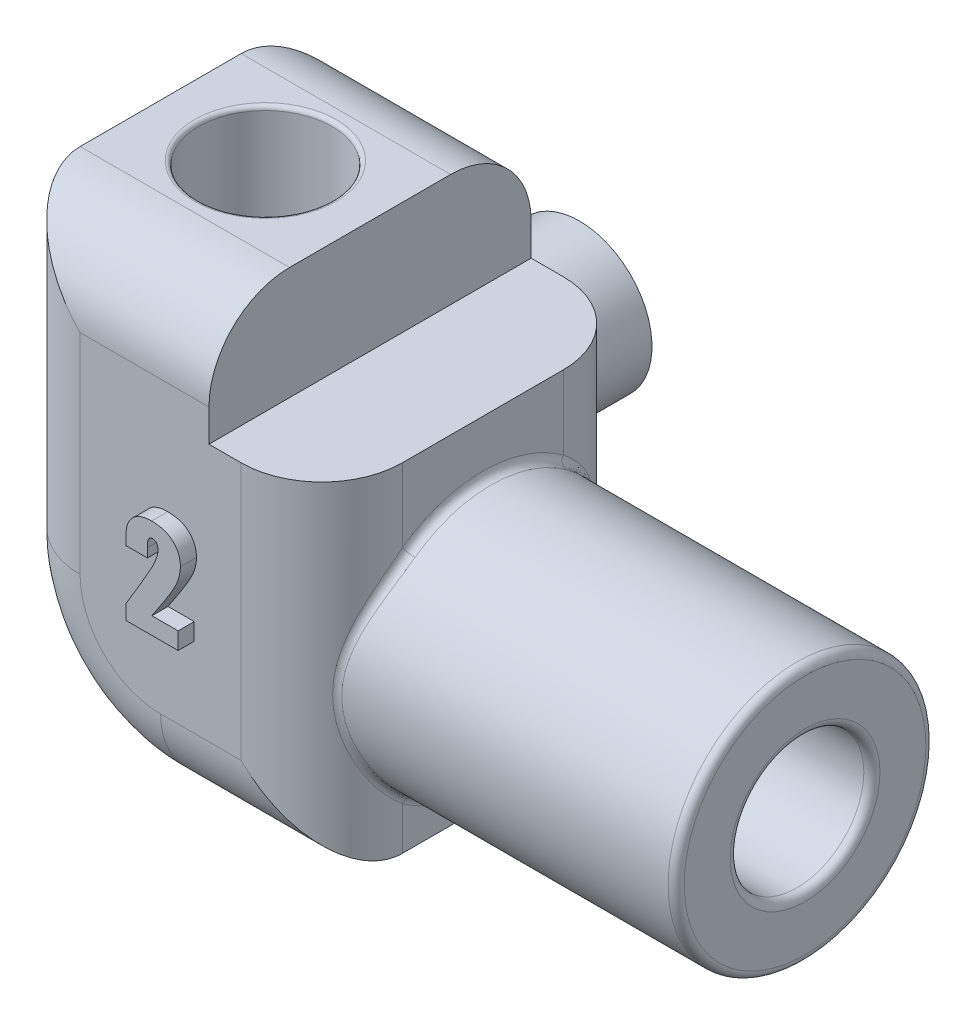
from build123d import *
from build123d.topology import SkipClean

# Parameters (mm, degrees)
BOSS_EXTRU_1_DEPTH       = 10
BOSS_EXTRU_1_DEPTH_BACK  = 10
ESQUISSE2_R              = 4
ENL_V_MAT_EXTRU_1_DEPTH  = 7
ESQUISSE3_W              = 20
ESQUISSE3_H              = 20
BOSS_EXTRU_2_DEPTH       = 8
EMPREINTE1_START         = -10
EMPREINTE1_OUTLINE_R     = 4
EMPREINTE1_DEPTH         = 14.813354444
CONG_1_R                 = 10
CONG_2_R                 = 5
ESQUISSE4_R              = 4.5
BOSS_EXTRU_3_DEPTH       = 6
ESQUISSE5_R              = 1.75
ENL_V_MAT_EXTRU_2_DEPTH  = 5
CONG_3_R                 = 0.25
ESQUISSE6_R              = 4.15
ENL_V_MAT_EXTRU_3_DEPTH  = 7
ESQUISSE7_R              = 4.15
ENL_V_MAT_EXTRU_4_DEPTH  = 14.813354444
BOSS_EXTRU_4_OUTLINE_R   = 8
BOSS_EXTRU_4_OUTLINE_R_2 = 4.15
BOSS_EXTRU_4_DEPTH       = 20
BOSS_EXTRU_4_START       = -5
BOSS_EXTRU_4_2_DEPTH     = 5
ESQUISSE9_R              = 8
ESQUISSE9_R_2            = 4.15
BOSS_EXTRU_6_DEPTH       = 22
CONG_5_R                 = 0.5
CONG_6_R                 = 0.25
CONG_7_R                 = 0.5
BOSS_EXTRU_7_DEPTH       = 1


with BuildPart() as part:
    # Esquisse1 → Boss.-Extru.1 (new, two sides: drawn at the far end of the back side and taken through both)
    with BuildSketch(Plane.XY.offset(-BOSS_EXTRU_1_DEPTH_BACK)):
        Polygon((-3, -10), (10, -10), (10, 10), (-10, 10), (-10, -3), (-3, -3), align=None)
    extrude(amount=BOSS_EXTRU_1_DEPTH + BOSS_EXTRU_1_DEPTH_BACK)

    # Esquisse2 → Enlèv. mat.-Extru.1 (cut)
    with BuildSketch(Plane(origin=(0, -10, 0), x_dir=(-1, 0, 0), z_dir=(0, -1, 0))):
        with Locations(Location((-3.5, 0, 0), (0, 0, 90))):
            Circle(ESQUISSE2_R)
    extrude(amount=-ENL_V_MAT_EXTRU_1_DEPTH, mode=Mode.SUBTRACT)

    # Esquisse3 → Boss.-Extru.2 (add)
    with BuildSketch(Plane(origin=(0, 10, 0), x_dir=(1, 0, 0), z_dir=(0, 1, 0))):
        Rectangle(ESQUISSE3_W, ESQUISSE3_H)
    extrude(amount=BOSS_EXTRU_2_DEPTH)

    # Empreinte1: read off the stored shape, not the designer's step
    # Empreinte1 outline → Empreinte1 (cut)
    with BuildSketch(Plane.YZ.offset(EMPREINTE1_START)):
        with Locations((8.447491166, 0)):
            Circle(EMPREINTE1_OUTLINE_R)
    extrude(amount=EMPREINTE1_DEPTH, mode=Mode.SUBTRACT)

    # Congé1
    cong_1_edges = [part.edges().sort_by_distance(p)[0] for p in [
        (10, 18, 0),
    ]]
    fillet(cong_1_edges, radius=CONG_1_R)

    # Congé2
    cong_2_edges = [part.edges().sort_by_distance(p)[0] for p in [
        (-10, 7.5, -10),
        (10, -1, 10),
        (-10, 7.5, 10),
        (3.5, -10, 10),
        (3.5, -10, -10),
        (-5, 18, 10),
        (10, -1, -10),
        (-5, 18, -10),
        (7.071067812, 15.071067812, -10),
        (7.071067812, 15.071067812, 10),
    ]]
    fillet(cong_2_edges, radius=CONG_2_R)


with BuildPart() as body_2:
    # Symétrie1: mirrored copy
    add(part.part.mirror(Plane(origin=(-3, -10, -10), x_dir=(0, 0, 1), z_dir=(0, -1, 0))))


with BuildPart() as body_2_2:
    # Symétrie3: mirrored copy
    add(body_2.part.mirror(Plane(origin=(-10, -27.201842148, 0), x_dir=(0, 0, 1), z_dir=(-1, 0, 0))))

    # Esquisse4 → Boss.-Extru.3 (add)
    with BuildSketch(Plane(origin=(0, 0, -10), x_dir=(-1, 0, 0), z_dir=(0, 0, -1))):
        with Locations((20, -24)):
            Circle(ESQUISSE4_R)
    extrude(amount=BOSS_EXTRU_3_DEPTH)

    # Esquisse5 → Enlèv. mat.-Extru.2 (cut)
    with BuildSketch(Plane(origin=(0, 0, -16), x_dir=(-1, 0, 0), z_dir=(0, 0, -1))):
        with Locations((20, -24)):
            Circle(ESQUISSE5_R)
    extrude(amount=-ENL_V_MAT_EXTRU_2_DEPTH, mode=Mode.SUBTRACT)

    # Congé3
    cong_3_edges = [body_2_2.edges().sort_by_distance(p)[0] for p in [
        (-23.5, -10, 4),
        (-10, -24.447491166, 0),
    ]]
    fillet(cong_3_edges, radius=CONG_3_R)

    # Esquisse6 → Enlèv. mat.-Extru.3 (cut)
    with BuildSketch(Plane(origin=(0, -10, 0), x_dir=(1, 0, 0), z_dir=(0, 1, 0))):
        with Locations(Location((-23.5, 0, 0), (0, 0, 270))):
            Circle(ESQUISSE6_R)
    extrude(amount=-ENL_V_MAT_EXTRU_3_DEPTH, mode=Mode.SUBTRACT)

    # Esquisse7 → Enlèv. mat.-Extru.4 (cut)
    with BuildSketch(Plane(origin=(-10, 0, 0), x_dir=(0, 0, -1), z_dir=(1, 0, 0))):
        with Locations((0, -28.447491166)):
            Circle(ESQUISSE7_R)
    extrude(amount=-ENL_V_MAT_EXTRU_4_DEPTH, mode=Mode.SUBTRACT)

    # Boss.-Extru.4: read off the stored shape, not the designer's step
    # Boss.-Extru.4 outline → Boss.-Extru.4 (add)
    with BuildSketch(Plane(origin=(-10, 0, 0), x_dir=(0, 0, -1), z_dir=(1, 0, 0))):
        with Locations((0, -28.447491166)):
            Circle(BOSS_EXTRU_4_OUTLINE_R)
        with Locations((0, -28.447491166)):
            Circle(BOSS_EXTRU_4_OUTLINE_R_2, mode=Mode.SUBTRACT)
    extrude(amount=BOSS_EXTRU_4_DEPTH)

    # Boss.-Extru.4 2 outline → Boss.-Extru.4 2 (add)
    with BuildSketch(Plane(origin=(-10, 0, 0), x_dir=(0, 0, -1), z_dir=(1, 0, 0)).offset(BOSS_EXTRU_4_START)):
        with BuildLine():
            ThreePointArc((5, -34.692489164), (8, -28.447491166), (5, -22.202493167))
            Line((5, -22.202493167), (5, -34.692489164))
        make_face()
    extrude(amount=BOSS_EXTRU_4_2_DEPTH)

    # Esquisse9 → Boss.-Extru.6 (add)
    with BuildSketch(Plane(origin=(10, 0, 0), x_dir=(0, 0, -1), z_dir=(1, 0, 0))):
        with Locations((0, -28.447491166)):
            Circle(ESQUISSE9_R)
        with Locations((0, -28.447491166)):
            Circle(ESQUISSE9_R_2, mode=Mode.SUBTRACT)
    extrude(amount=-BOSS_EXTRU_6_DEPTH)

    # Congé5
    cong_5_edges = [body_2_2.edges().sort_by_distance(p)[0] for p in [
        (10, -28.447491166, 8),
        (10, -28.447491166, 4.15),
    ]]
    fillet(cong_5_edges, radius=CONG_5_R)

    # Congé6
    cong_6_edges = [body_2_2.edges().sort_by_distance(p)[0] for p in [
        (-27.65, -10.020871215, 0),
    ]]
    fillet(cong_6_edges, radius=CONG_6_R - 0.0001)  # a hair under: the kernel refuses the full size

    # Congé7
    cong_7_edges = [body_2_2.edges().sort_by_distance(p)[0] for p in [
        (-10, -20.447491166, 0),
        (-10, -36.447491166, 0),
        (-10.515053697, -24.981639584, -7.210261604),
        (-11, -28.447491166, 8),
    ]]
    fillet(cong_7_edges, radius=CONG_7_R)

    # Esquisse10 → Boss.-Extru.7 (add)
    with SkipClean():  # the faces are left unmerged after this step: merging them gives an invalid solid
        with BuildSketch(Plane.XY.offset(10)):
            with BuildLine():
                Line((-17.914439845, -26.991133049), (-17.914439845, -28.049956579))
                Line((-17.914439845, -28.049956579), (-21.161498669, -28.049956579))
                Line((-21.161498669, -28.049956579), (-21.14385161, -27.13230952))
                add(Edge.make_bspline(
                    [(-21.14385161, -27.13230952), (-21.085330493, -27.035657743), (-20.971293004, -26.847316737), (-20.805569177, -26.571160217), (-20.649708691, -26.30894366), (-20.500982008, -26.061922707), (-20.363655715, -25.82792589), (-20.234498529, -25.608507854), (-20.114242126, -25.403380526), (-20.003004003, -25.212480489), (-19.89975554, -25.036239308), (-19.807956366, -24.873041233), (-19.723461905, -24.724892811), (-19.648499261, -24.590873041), (-19.583592176, -24.470356777), (-19.52682163, -24.364372451), (-19.479923667, -24.272179766), (-19.428736739, -24.170544668), (-19.375238067, -24.056191538), (-19.320229511, -23.926611984), (-19.273668419, -23.804431811), (-19.234320132, -23.690762422), (-19.206393276, -23.583865679), (-19.182770223, -23.485720232), (-19.170706841, -23.394377463), (-19.168448783, -23.336011708), (-19.167381022, -23.308412461)],
                    knots=[0, 0, 0, 0, 1.878632119, 3.660806617, 5.354925918, 6.950497641, 8.454906782, 9.866025726, 11.183856988, 12.408403659, 13.539669594, 14.579925142, 15.521615084, 16.375397362, 17.133040409, 17.797539483, 18.374382612, 18.852785517, 19.689593001, 20.472986981, 21.192742555, 21.863510099, 22.471481032, 23.029088424, 23.540887823, 24, 24, 24, 24], degree=3))
                add(Edge.make_bspline(
                    [(-19.167381022, -23.308412461), (-19.168522464, -23.270505605), (-19.170659494, -23.199535639), (-19.183969296, -23.100308638), (-19.208940963, -23.016264918), (-19.244463305, -22.947008777), (-19.290324008, -22.891644258), (-19.348956069, -22.852858629), (-19.418414879, -22.830586133), (-19.467950768, -22.827855128), (-19.49385161, -22.826427167)],
                    knots=[0, 0, 0, 0, 1.376412982, 2.576947615, 3.62402596, 4.543455686, 5.386042377, 6.20416995, 7.061013909, 8, 8, 8, 8], degree=3))
                add(Edge.make_bspline(
                    [(-19.49385161, -22.826427167), (-19.519796137, -22.827672631), (-19.569655643, -22.83006613), (-19.639353636, -22.855147332), (-19.697785845, -22.897600452), (-19.73578457, -22.946569207), (-19.760117123, -22.994520235), (-19.776963013, -23.039140635), (-19.788850505, -23.092049949), (-19.801913247, -23.152089926), (-19.810301788, -23.220729243), (-19.814901888, -23.297349245), (-19.820222965, -23.381875241), (-19.82028805, -23.440755099), (-19.820322198, -23.471647755)],
                    knots=[0, 0, 0, 0, 1.138253241, 2.187465046, 3.206937327, 4.278370201, 4.878997099, 5.57020963, 6.370754862, 7.262421596, 8.273901937, 9.409391864, 10.640778526, 12, 12, 12, 12], degree=3))
                Line((-19.820322198, -23.471647755), (-19.820322198, -24.026427167))
                Line((-19.820322198, -24.026427167), (-21.161498669, -24.026427167))
                Line((-21.161498669, -24.026427167), (-21.161498669, -23.811353637))
                add(Edge.make_bspline(
                    [(-21.161498669, -23.811353637), (-21.160964042, -23.733399707), (-21.159952299, -23.585877328), (-21.149897147, -23.377664925), (-21.135091089, -23.195446413), (-21.114143598, -23.034545442), (-21.078155753, -22.886835133), (-21.022920944, -22.745173289), (-20.950874917, -22.603878394), (-20.859884594, -22.466709389), (-20.753665594, -22.3365511), (-20.628405643, -22.223079415), (-20.488329389, -22.12684407), (-20.333437785, -22.04624286), (-20.16212474, -21.985296124), (-19.97598891, -21.939799212), (-19.77364698, -21.913465048), (-19.633635132, -21.91037847), (-19.561131022, -21.908780108)],
                    knots=[0, 0, 0, 0, 1.302330156, 2.46456904, 3.481715288, 4.3564703, 5.172861994, 6.014736497, 6.891064404, 7.817842123, 8.760022951, 9.690518237, 10.631035726, 11.592579611, 12.599117381, 13.66133539, 14.788939649, 16, 16, 16, 16], degree=3))
                add(Edge.make_bspline(
                    [(-19.561131022, -21.908780108), (-19.489747248, -21.909855443), (-19.351063437, -21.911944594), (-19.149820476, -21.933659186), (-18.961770909, -21.966784716), (-18.787058332, -22.015615315), (-18.625834023, -22.078170365), (-18.478026792, -22.15435911), (-18.34402816, -22.244688982), (-18.223942961, -22.348243364), (-18.11861368, -22.46317462), (-18.026085985, -22.585336145), (-17.947659044, -22.714636834), (-17.882724812, -22.851066777), (-17.834551336, -22.995777397), (-17.799619561, -23.147186941), (-17.776246289, -23.305852707), (-17.774270489, -23.414209652), (-17.773263375, -23.469441873)],
                    knots=[0, 0, 0, 0, 1.276486122, 2.479946816, 3.616419319, 4.68874101, 5.719519015, 6.704924401, 7.657090594, 8.60369864, 9.534525517, 10.440795938, 11.340864614, 12.235220652, 13.137832645, 14.063090053, 15.012709005, 16, 16, 16, 16], degree=3))
                add(Edge.make_bspline(
                    [(-17.773263375, -23.469441873), (-17.774206156, -23.512483861), (-17.776111359, -23.599464562), (-17.788811747, -23.730915246), (-17.808573814, -23.8642018), (-17.836343243, -23.999752388), (-17.872592554, -24.136681744), (-17.91752128, -24.275551012), (-17.968797329, -24.416502083), (-18.020028449, -24.536213265), (-18.067939353, -24.6375307), (-18.111302047, -24.724527064), (-18.163245277, -24.820998678), (-18.222821958, -24.927987961), (-18.290209841, -25.044851124), (-18.365213419, -25.17169791), (-18.448368635, -25.30857156), (-18.538107257, -25.456069286), (-18.637131956, -25.612888592), (-18.742420743, -25.780782398), (-18.857291879, -25.957415996), (-18.978818865, -26.144896482), (-19.109040012, -26.341425424), (-19.245832031, -26.549613738), (-19.390987077, -26.767310848), (-19.491192471, -26.915455425), (-19.542381022, -26.991133049)],
                    knots=[0, 0, 0, 0, 0.776012351, 1.568191902, 2.379092226, 3.204599703, 4.061576992, 4.93155591, 5.835421489, 6.765002259, 7.277989153, 7.856056878, 8.51736844, 9.253274835, 10.063958385, 10.949555224, 11.910169643, 12.951531559, 14.062409461, 15.254103561, 16.524621957, 17.861273306, 19.282432554, 20.775291365, 22.352701857, 24, 24, 24, 24], degree=3))
                Line((-19.542381022, -26.991133049), (-17.914439845, -26.991133049))
            make_face()
        extrude(amount=BOSS_EXTRU_7_DEPTH)


solid = body_2_2.part
